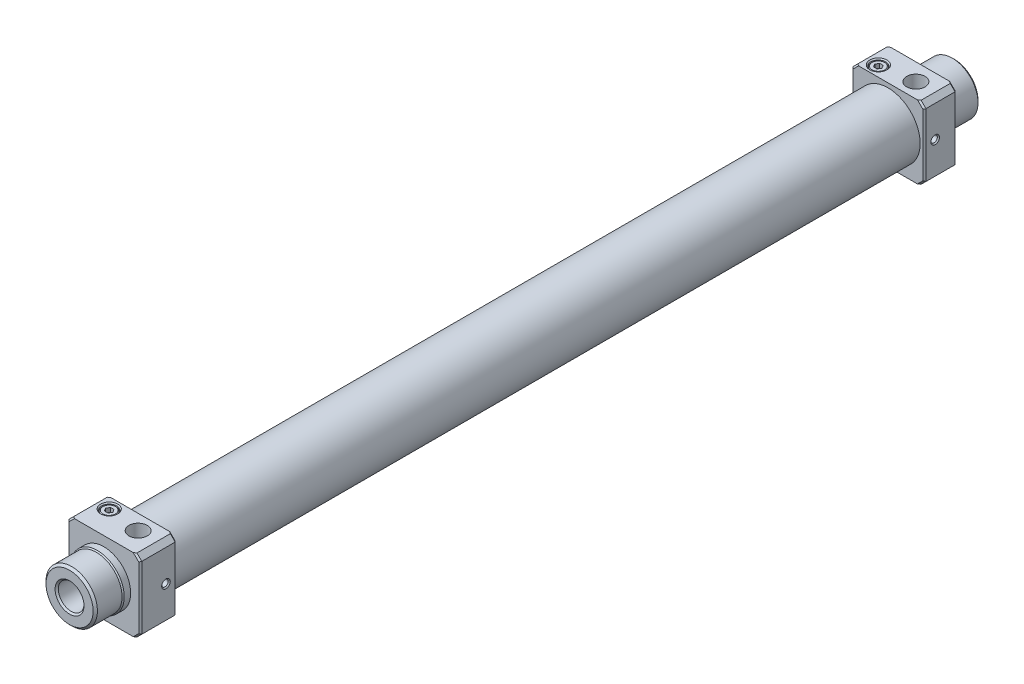
from build123d import *

# Parameters (mm, degrees)
SKETCH1_R                = 15
BOSS_EXTRUDE1_DEPTH      = 190.5
SKETCH2_W                = 34
SKETCH2_H                = 34
BOSS_EXTRUDE2_DEPTH      = 17
SKETCH3_W                = 34
SKETCH3_H                = 34
BOSS_EXTRUDE3_DEPTH      = 15
CHAMFER2_SIZE            = 2.26
CHAMFER3_SIZE            = 0.707
SKETCH4_R                = 12.5
BOSS_EXTRUDE4_DEPTH      = 3
BOSS_EXTRUDE5_START      = 3
SKETCH5_R                = 12.5
BOSS_EXTRUDE5_DEPTH      = 3
SKETCH8_R                = 12
BOSS_EXTRUDE6_DEPTH      = 13
CHAMFER4_SIZE            = 0.5
BOSS_EXTRUDE7_START      = 13
SKETCH9_R                = 12
BOSS_EXTRUDE7_DEPTH      = 13
CHAMFER5_SIZE            = 0.5
CHAMFER6_SIZE            = 1
CHAMFER10_SIZE           = 1
SKETCH6_R                = 12.5
CUT_EXTRUDE1_DEPTH       = 152.5
SKETCH7_R                = 6
CUT_EXTRUDE2_DEPTH       = 208.89480513
CHAMFER7_SIZE            = 0.75
SKETCH10_R               = 3.5
SKETCH10_R_2             = 3.3
CUT_EXTRUDE3_DEPTH       = 2.5
SKETCH12_R               = 3.3
CUT_EXTRUDE4_DEPTH       = 0.5
CHAMFER8_SIZE            = 0.35
CUT_EXTRUDE5_DEPTH       = 2
SKETCH14_R               = 4
SKETCH14_R_2             = 3.5
CUT_EXTRUDE6_DEPTH       = 0.5
CHAMFER9_SIZE            = 0.5
CHAMFER8_OF_MIRROR1_SIZE = 0.35
CHAMFER9_OF_MIRROR1_SIZE = 0.5
SKETCH19_R               = 1.5
CUT_EXTRUDE8_DEPTH       = 6
CHAMFER11_SIZE           = 0.5
G1_8_TAPPED_HOLE1_D      = 8.566
G1_8_TAPPED_HOLE1_DEPTH  = 25
G1_8_TAPPED_HOLE1_TIP    = 2.573486031


with BuildPart() as part:
    # Sketch1 → Boss-Extrude1 (new, symmetric)
    with BuildSketch(Plane.XY):
        Circle(SKETCH1_R)
    extrude(amount=BOSS_EXTRUDE1_DEPTH, both=True)

    # Sketch2 → Boss-Extrude2 (add)
    with BuildSketch(Plane.XY.offset(190.5)):
        Rectangle(SKETCH2_W, SKETCH2_H)
    extrude(amount=-BOSS_EXTRUDE2_DEPTH)

    # Sketch3 → Boss-Extrude3 (add)
    with BuildSketch(Plane(origin=(0, 0, -190.5), x_dir=(-1, 0, 0), z_dir=(0, 0, -1))):
        Rectangle(SKETCH3_W, SKETCH3_H)
    extrude(amount=-BOSS_EXTRUDE3_DEPTH)

    # Chamfer2
    chamfer2_edges = [part.edges().sort_by_distance(p)[0] for p in [
        (-17, 17, -183),
        (-17, -17, -183),
        (17, -17, -183),
        (17, 17, -183),
        (17, 17, 182),
        (17, -17, 182),
        (-17, -17, 182),
        (-17, 17, 182),
    ]]
    chamfer(chamfer2_edges, length=CHAMFER2_SIZE)

    # Chamfer3
    chamfer3_edges = [part.edges().sort_by_distance(p)[0] for p in [
        (-17, 0, -190.5),
        (17, 0, -190.5),
        (-15.87, 15.87, -190.5),
        (15.87, 15.87, -190.5),
        (15.87, -15.87, -190.5),
        (-15.87, -15.87, -190.5),
        (-17, 0, -175.5),
        (17, 0, -175.5),
        (-15.87, 15.87, -175.5),
        (15.87, 15.87, -175.5),
        (15.87, -15.87, -175.5),
        (-15.87, -15.87, -175.5),
        (-17, 0, 190.5),
        (-17, 0, 173.5),
        (17, 0, 190.5),
        (15.87, 15.87, 190.5),
        (-15.87, 15.87, 190.5),
        (15.87, -15.87, 190.5),
        (-15.87, -15.87, 190.5),
        (17, 0, 173.5),
        (15.87, 15.87, 173.5),
        (-15.87, 15.87, 173.5),
        (15.87, -15.87, 173.5),
        (-15.87, -15.87, 173.5),
    ]]
    chamfer(chamfer3_edges, length=CHAMFER3_SIZE)

    # Sketch4 → Boss-Extrude4 (add)
    with BuildSketch(Plane(origin=(0, 0, -190.5), x_dir=(-1, 0, 0), z_dir=(0, 0, -1))):
        with Locations(Location((0, 0, 0), (0, 0, 180))):
            Circle(SKETCH4_R)
    extrude(amount=BOSS_EXTRUDE4_DEPTH)

    # Sketch5 → Boss-Extrude5 (add)
    with BuildSketch(Plane.XY.offset(190.5).offset(BOSS_EXTRUDE5_START)):
        Circle(SKETCH5_R)
    extrude(amount=-BOSS_EXTRUDE5_DEPTH)

    # Sketch8 → Boss-Extrude6 (add)
    with BuildSketch(Plane.XY.offset(193.5)):
        with Locations(Location((0, 0, 0), (0, 0, 180))):
            Circle(SKETCH8_R)
    extrude(amount=BOSS_EXTRUDE6_DEPTH)

    # Chamfer4
    chamfer4_edges = [part.edges().sort_by_distance(p)[0] for p in [
        (12, 0, 193.5),
    ]]
    chamfer(chamfer4_edges, length=CHAMFER4_SIZE - 0.0001)  # a hair under: the kernel refuses the full size

    # Sketch9 → Boss-Extrude7 (add)
    with BuildSketch(Plane(origin=(0, 0, -193.5), x_dir=(-1, 0, 0), z_dir=(0, 0, -1)).offset(BOSS_EXTRUDE7_START)):
        Circle(SKETCH9_R)
    extrude(amount=-BOSS_EXTRUDE7_DEPTH)

    # Chamfer5
    chamfer5_edges = [part.edges().sort_by_distance(p)[0] for p in [
        (12, 0, -193.5),
    ]]
    chamfer(chamfer5_edges, length=CHAMFER5_SIZE - 0.0001)  # a hair under: the kernel refuses the full size

    # Chamfer6
    chamfer6_edges = [part.edges().sort_by_distance(p)[0] for p in [
        (12, 0, 206.5),
    ]]
    chamfer(chamfer6_edges, length=CHAMFER6_SIZE)

    # Chamfer10
    chamfer10_edges = [part.edges().sort_by_distance(p)[0] for p in [
        (12, 0, -206.5),
    ]]
    chamfer(chamfer10_edges, length=CHAMFER10_SIZE)

    # Sketch6 → Cut-Extrude1 (cut, symmetric)
    with BuildSketch(Plane.XY):
        Circle(SKETCH6_R)
    extrude(amount=CUT_EXTRUDE1_DEPTH, both=True, mode=Mode.SUBTRACT)

    # Sketch7 → Cut-Extrude2 (cut, through all)
    with BuildSketch(Plane.XY):
        Circle(SKETCH7_R)
    extrude(amount=CUT_EXTRUDE2_DEPTH, mode=Mode.SUBTRACT)

    # Chamfer7
    chamfer7_edges = [part.edges().sort_by_distance(p)[0] for p in [
        (-6, 0, 206.5),
    ]]
    chamfer(chamfer7_edges, length=CHAMFER7_SIZE)

    # Sketch10 → Cut-Extrude3 (cut)
    with BuildSketch(Plane(origin=(0, 17, 0), x_dir=(1, 0, 0), z_dir=(0, 1, 0))):
        with Locations(Location((-9.5, -178.5, 0), (0, 0, 270))):
            Circle(SKETCH10_R)
        with Locations(Location((-9.5, -178.5, 0), (0, 0, 270))):
            Circle(SKETCH10_R_2, mode=Mode.SUBTRACT)
    cut_extrude3 = extrude(amount=-CUT_EXTRUDE3_DEPTH, mode=Mode.SUBTRACT)

    # Sketch12 → Cut-Extrude4 (cut)
    with BuildSketch(Plane(origin=(0, 17, 0), x_dir=(1, 0, 0), z_dir=(0, 1, 0))):
        with Locations(Location((-9.5, -178.5, 0), (0, 0, 270))):
            Circle(SKETCH12_R)
    cut_extrude4 = extrude(amount=-CUT_EXTRUDE4_DEPTH, mode=Mode.SUBTRACT)

    # Chamfer8
    chamfer8_edges = [part.edges().sort_by_distance(p)[0] for p in [
        (-9.5, 16.5, 175.2),
    ]]
    chamfer(chamfer8_edges, length=CHAMFER8_SIZE)

    # Sketch13 → Cut-Extrude5 (cut)
    with BuildSketch(Plane(origin=(0, 16.5, 0), x_dir=(1, 0, 0), z_dir=(0, 1, 0))):
        Polygon((-7.825684219, -178.5), (-8.66284211, -177.05), (-10.33715789, -177.05), (-11.174315781, -178.5), (-10.33715789, -179.95), (-8.66284211, -179.95), align=None)
    cut_extrude5 = extrude(amount=-CUT_EXTRUDE5_DEPTH, mode=Mode.SUBTRACT)

    # Sketch14 → Cut-Extrude6 (cut)
    with BuildSketch(Plane(origin=(0, 17, 0), x_dir=(1, 0, 0), z_dir=(0, 1, 0))):
        with Locations(Location((-9.5, -178.5, 0), (0, 0, 270))):
            Circle(SKETCH14_R)
        with Locations(Location((-9.5, -178.5, 0), (0, 0, 270))):
            Circle(SKETCH14_R_2, mode=Mode.SUBTRACT)
    cut_extrude6 = extrude(amount=-CUT_EXTRUDE6_DEPTH, mode=Mode.SUBTRACT)

    # Chamfer9
    chamfer9_edges = [part.edges().sort_by_distance(p)[0] for p in [
        (-9.5, 16.5, 174.5),
    ]]
    chamfer(chamfer9_edges, length=CHAMFER9_SIZE - 0.0001)  # a hair under: the kernel refuses the full size

    # Mirror1: Cut-Extrude3, Cut-Extrude4, Cut-Extrude5, Cut-Extrude6 across plane
    add(cut_extrude3.mirror(Plane.XY.offset(-1)), mode=Mode.SUBTRACT)
    add(cut_extrude4.mirror(Plane.XY.offset(-1)), mode=Mode.SUBTRACT)
    add(cut_extrude5.mirror(Plane.XY.offset(-1)), mode=Mode.SUBTRACT)
    add(cut_extrude6.mirror(Plane.XY.offset(-1)), mode=Mode.SUBTRACT)

    # Chamfer8 of Mirror1
    chamfer8_of_mirror1_edges = [part.edges().sort_by_distance(p)[0] for p in [
        (-9.5, 16.5, -177.2),
    ]]
    chamfer(chamfer8_of_mirror1_edges, length=CHAMFER8_OF_MIRROR1_SIZE)

    # Chamfer9 of Mirror1
    chamfer9_of_mirror1_edges = [part.edges().sort_by_distance(p)[0] for p in [
        (-9.5, 16.5, -176.5),
    ]]
    chamfer(chamfer9_of_mirror1_edges, length=CHAMFER9_OF_MIRROR1_SIZE - 0.0001)  # a hair under: the kernel refuses the full size

    # Sketch19 → Cut-Extrude8 (cut)
    with BuildSketch(Plane(origin=(17, 0, 0), x_dir=(0, 0, -1), z_dir=(1, 0, 0))):
        with Locations((-178.5, 0)):
            Circle(SKETCH19_R)
    cut_extrude8 = extrude(amount=-CUT_EXTRUDE8_DEPTH, mode=Mode.SUBTRACT)

    # Mirror3: Cut-Extrude8 across plane
    add(cut_extrude8.mirror(Plane.XY.offset(-1)), mode=Mode.SUBTRACT)

    # Chamfer11
    chamfer11_edges = [part.edges().sort_by_distance(p)[0] for p in [
        (17, 0, 180),
        (17, 0, -182),
    ]]
    chamfer(chamfer11_edges, length=CHAMFER11_SIZE)

    # G1/8 Tapped Hole1
    with Locations(Plane(origin=(0, 17, 0), x_dir=(-1, 0, 0), z_dir=(0, 1, 0))):
        with Locations((-6, 180.5), (-6, -182.5)):
            Hole(G1_8_TAPPED_HOLE1_D / 2, depth=G1_8_TAPPED_HOLE1_DEPTH)
            with Locations((0, 0, -(G1_8_TAPPED_HOLE1_DEPTH + G1_8_TAPPED_HOLE1_TIP / 2))):  # 118° drill point
                Cone(0, G1_8_TAPPED_HOLE1_D / 2, G1_8_TAPPED_HOLE1_TIP, mode=Mode.SUBTRACT)


solid = part.part
